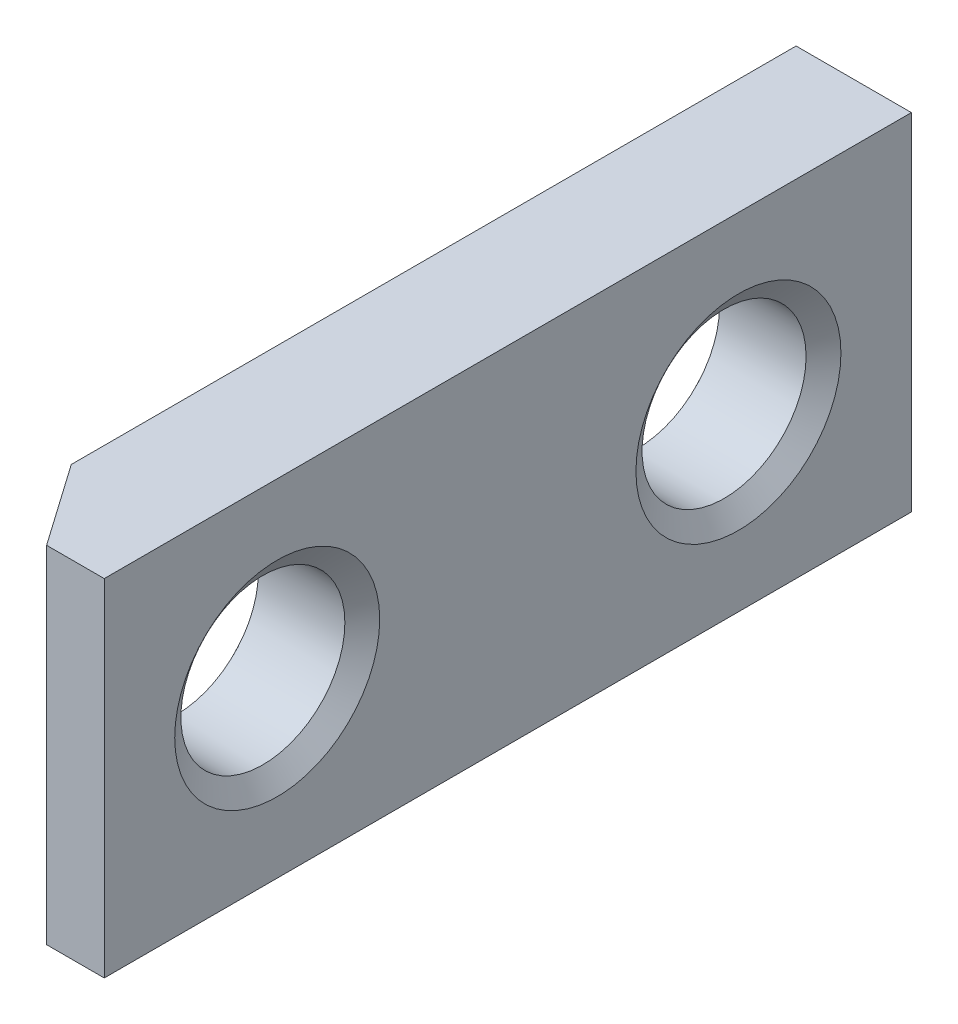
from build123d import *

# Parameters (mm, degrees)
SKETCH_1_W                   = 14
SKETCH_1_H                   = 6
EXTRUDE_1_DEPTH              = 2
HOLE_WIZARD_4_401_AT_2_COUNT = 2
HOLE_WIZARD_4_401_AT_2_PITCH = 8
CHAMFER_1_SIZE               = 1
CHAMFER_1_SIZE_2             = 1.428148007


with BuildPart() as part:
    # Эскиз1 → Бобышка-Вытянуть1 (new body)
    with BuildSketch(Plane(origin=(0, 0, 0), x_dir=(0, 0, -1), z_dir=(1, 0, 0))):
        Rectangle(SKETCH_1_W, SKETCH_1_H)
    extrude(amount=EXTRUDE_1_DEPTH)

    # Эскиз4 → Отверстие обработанное метчиком #4-401 (revolve, cut)
    with BuildSketch(Plane(origin=(2, 0, 4), x_dir=(0, 0, -1), z_dir=(0, 1, 0))):
        Polygon((0, 0), (0, 2), (1.778, 2), (1.4224, 1.751006199), (1.4224, 0.248993801), (1.778, 0), align=None)
    hole_wizard_4_401 = revolve(axis=Axis((8.35, 0, 4), (-1, 0, 0)), mode=Mode.SUBTRACT)

    # Отверстие обработанное метчиком #4-401 at 2: Отверстие обработанное метчиком #4-401 ×2
    with Locations(*[(0, 0, -i * HOLE_WIZARD_4_401_AT_2_PITCH) for i in range(1, HOLE_WIZARD_4_401_AT_2_COUNT)]):
        add(hole_wizard_4_401, mode=Mode.SUBTRACT)

    # Фаска1
    # the kernel refuses this chamfer: 1.428148007, 1 mm, written as the material it takes off along each edge
    with BuildSketch(Plane(origin=(0, 6.68826682, 7), x_dir=(0.9989750717851554, 0, 0.04526373771402103), z_dir=(0, -1, 0))) as chamfer_1_piece_1:
        Polygon((CHAMFER_1_SIZE * 0.998975071785, -CHAMFER_1_SIZE * 0.045263737714), (-CHAMFER_1_SIZE_2 * 0.0452637377058, -CHAMFER_1_SIZE_2 * 0.998975071605), (0, 0), align=None)
    extrude(amount=13.37653364, mode=Mode.SUBTRACT)


solid = part.part
